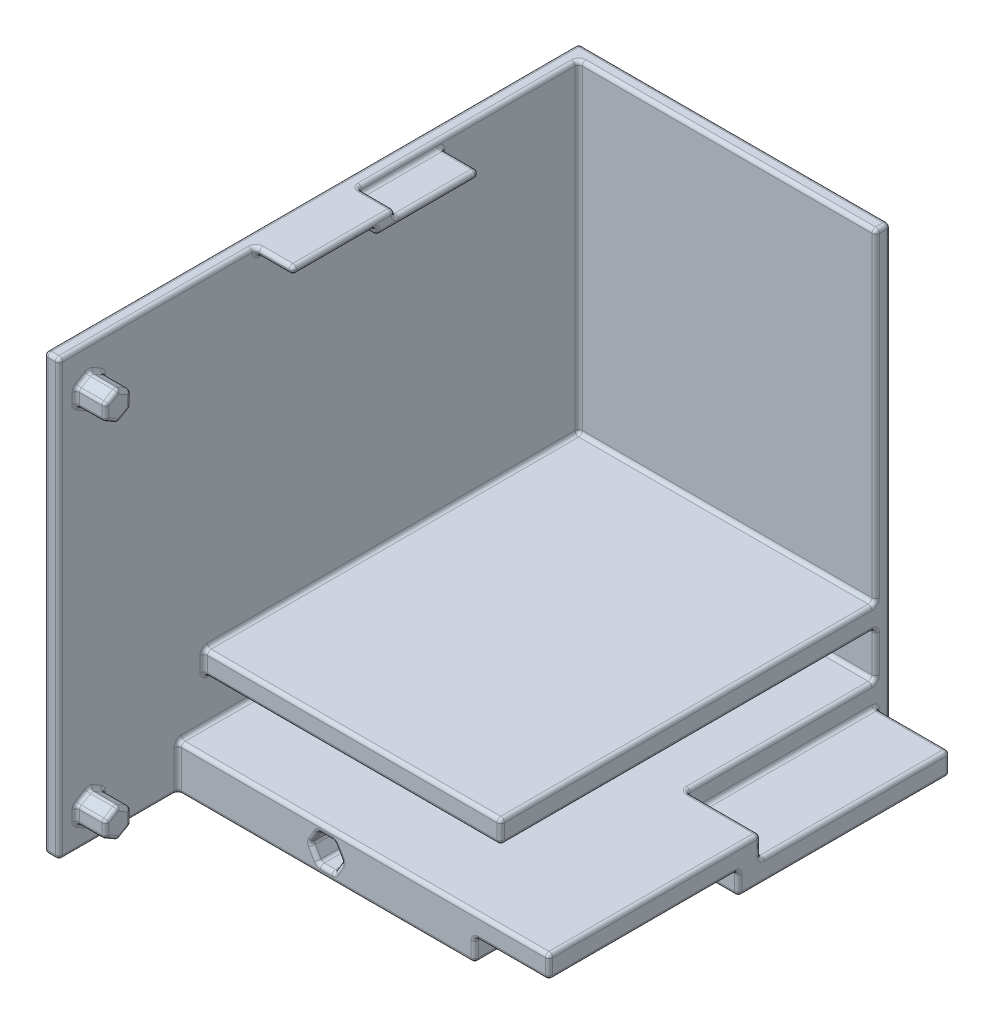
from build123d import *

# Parameters (mm, degrees)
SKETCH3_W            = 144
SKETCH3_H            = 117
BOSS_EXTRUDE2_DEPTH  = 4
BOSS_EXTRUDE3_DEPTH  = 12
BOSS_EXTRUDE4_DEPTH  = 10
SKETCH7_W            = 4
SKETCH7_H            = 117
BOSS_EXTRUDE5_DEPTH  = 80
BOSS_EXTRUDE8_DEPTH  = 20
SKETCH8_W            = 108
SKETCH8_H            = 12
BOSS_EXTRUDE9_DEPTH  = 80
CUT_EXTRUDE1_DEPTH   = 10
SKETCH12_W           = 84
SKETCH12_H           = 6
BOSS_EXTRUDE10_DEPTH = 105
FILLET2_R            = 1


with BuildPart() as part:
    # Sketch3 → Boss-Extrude2 (new body)
    with BuildSketch(Plane(origin=(0, 0, 0), x_dir=(0, 0, -1), z_dir=(1, 0, 0))):
        Rectangle(SKETCH3_W, SKETCH3_H)
    extrude(amount=BOSS_EXTRUDE2_DEPTH)

    # Sketch5 → Boss-Extrude3 (add)
    with BuildSketch(Plane.ZY):
        Polygon((64, -45.67390752), (67.464101615, -47.67390752), (67.464101615, -51.67390752), (64, -53.67390752), (60.535898385, -51.67390752), (60.535898385, -47.67390752), align=None)
        Polygon((60.535898385, 49.67390752), (60.535898385, 45.67390752), (64, 43.67390752), (67.464101615, 45.67390752), (67.464101615, 49.67390752), (64, 51.67390752), align=None)
    extrude(amount=-BOSS_EXTRUDE3_DEPTH)

    # Sketch6 → Boss-Extrude4 (add)
    with BuildSketch(Plane(origin=(4, 0, 0), x_dir=(0, 0, -1), z_dir=(1, 0, 0))):
        Polygon((-19, 58.5), (-19, 56.5), (3.5, 56.5), (3.5, 54.5), (31, 54.5), (31, 56.5), (8.5, 56.5), (8.5, 58.5), align=None)
    extrude(amount=BOSS_EXTRUDE4_DEPTH)

    # Sketch7 → Boss-Extrude5 (add)
    with BuildSketch(Plane(origin=(4, 0, 0), x_dir=(0, 0, -1), z_dir=(1, 0, 0))):
        with Locations((70, 0)):
            Rectangle(SKETCH7_W, SKETCH7_H)
    extrude(amount=BOSS_EXTRUDE5_DEPTH)



with BuildPart() as body_2:
    # Sketch9 → Boss-Extrude8 (new body)
    with BuildSketch(Plane(origin=(84, 0, 0), x_dir=(0, 0, -1), z_dir=(1, 0, 0))):
        Polygon((-40, -46.5), (17, -46.5), (17, -52.5), (68, -52.5), (68, -58.5), (11, -58.5), (11, -52.5), (-40, -52.5), align=None)
    extrude(amount=BOSS_EXTRUDE8_DEPTH)


with BuildPart() as part_1:
    add(part.part)

    add(body_2.part)  # Boss-Extrude9 merges body 2
    # Sketch8 → Boss-Extrude9 (add)
    with BuildSketch(Plane(origin=(4, 0, 0), x_dir=(0, 0, -1), z_dir=(1, 0, 0))):
        with Locations((14, -52.5)):
            Rectangle(SKETCH8_W, SKETCH8_H)
    extrude(amount=BOSS_EXTRUDE9_DEPTH)

    # Sketch10 → Cut-Extrude1 (cut)
    with BuildSketch(Plane.XY.offset(40)):
        Polygon((41.9, -48.862693304), (39.8, -52.5), (44, -52.5), (44, -56.137306696), (46.1, -56.137306696), (48.2, -52.5), (46.1, -48.862693304), align=None)
        Polygon((44, -52.5), (39.8, -52.5), (41.9, -56.137306696), (44, -56.137306696), align=None)
    extrude(amount=-CUT_EXTRUDE1_DEPTH, mode=Mode.SUBTRACT)

    # Sketch12 → Boss-Extrude10 (add)
    with BuildSketch(Plane(origin=(0, 0, -72), x_dir=(-1, 0, 0), z_dir=(0, 0, -1))):
        with Locations((-42, -31.5)):
            Rectangle(SKETCH12_W, SKETCH12_H)
    extrude(amount=-BOSS_EXTRUDE10_DEPTH)

    # Fillet2
    fillet2_edges = [part_1.edges().sort_by_distance(p)[0] for p in [
        (4, 58.5, -38.25),
        (4, 15, -68),
        (44, 58.5, -68),
        (84, 0, -72),
        (84, 58.5, -70),
        (84, 15, -68),
        (84, -58.5, 14.5),
        (4, 0, 72),
        (4, -46.5, -14),
        (44, -46.5, -68),
        (4, -52.5, 40),
        (54, -46.5, 40),
        (44, -58.5, 40),
        (84, -46.5, -42.5),
        (84, -55.5, 40),
        (84, -58.5, -70),
        (84, -52.5, -42.5),
        (94, -52.5, -68),
        (84, -49.5, -17),
        (94, -52.5, -17),
        (94, -46.5, -17),
        (84, -52.5, 14.5),
        (94, -52.5, 40),
        (84, -55.5, -11),
        (94, -52.5, -11),
        (94, -58.5, -11),
        (84, -55.5, -68),
        (94, -58.5, -68),
        (104, -52.5, -42.5),
        (104, -49.5, -17),
        (104, -46.5, 11.5),
        (104, -49.5, 40),
        (104, -52.5, 14.5),
        (104, -55.5, -11),
        (104, -58.5, -39.5),
        (104, -55.5, -68),
        (4, -58.5, 56),
        (44, -56.137306696, 30),
        (46.1, -56.137306696, 35),
        (40.85, -54.318653348, 30),
        (41.9, -56.137306696, 35),
        (40.85, -50.681346652, 30),
        (39.8, -52.5, 35),
        (44, -48.862693304, 30),
        (41.9, -48.862693304, 35),
        (47.15, -50.681346652, 30),
        (46.1, -48.862693304, 35),
        (47.15, -54.318653348, 30),
        (48.2, -52.5, 35),
        (44, -56.137306696, 40),
        (47.15, -54.318653348, 40),
        (47.15, -50.681346652, 40),
        (44, -48.862693304, 40),
        (40.85, -50.681346652, 40),
        (40.85, -54.318653348, 40),
        (84, -40.5, -68),
        (4, -40.5, -68),
        (84, -31.5, 33),
        (84, -34.5, -17.5),
        (44, -34.5, -68),
        (44, -28.5, -68),
        (44, -34.5, 33),
        (4, -34.5, -17.5),
        (4, -28.5, -17.5),
        (44, -28.5, 33),
        (84, -28.5, -17.5),
        (4, -31.5, 33),
        (4, -46.67390752, 65.732050808),
        (4, -49.67390752, 67.464101615),
        (4, -52.67390752, 65.732050808),
        (4, -52.67390752, 62.267949192),
        (4, -49.67390752, 60.535898385),
        (4, -46.67390752, 62.267949192),
        (8, -45.67390752, 64),
        (8, -47.67390752, 67.464101615),
        (8, -51.67390752, 67.464101615),
        (8, -53.67390752, 64),
        (8, -51.67390752, 60.535898385),
        (8, -47.67390752, 60.535898385),
        (12, -46.67390752, 65.732050808),
        (12, -49.67390752, 67.464101615),
        (12, -52.67390752, 65.732050808),
        (12, -52.67390752, 62.267949192),
        (12, -49.67390752, 60.535898385),
        (12, -46.67390752, 62.267949192),
        (0, -58.5, 0),
        (8, 45.67390752, 60.535898385),
        (4, 47.67390752, 60.535898385),
        (12, 47.67390752, 60.535898385),
        (8, 49.67390752, 60.535898385),
        (4, 50.67390752, 62.267949192),
        (12, 50.67390752, 62.267949192),
        (8, 51.67390752, 64),
        (4, 50.67390752, 65.732050808),
        (12, 50.67390752, 65.732050808),
        (8, 49.67390752, 67.464101615),
        (4, 47.67390752, 67.464101615),
        (12, 47.67390752, 67.464101615),
        (8, 45.67390752, 67.464101615),
        (4, 44.67390752, 65.732050808),
        (12, 44.67390752, 65.732050808),
        (8, 43.67390752, 64),
        (4, 44.67390752, 62.267949192),
        (0, 0, 72),
        (12, 44.67390752, 62.267949192),
        (0, 58.5, 0),
        (0, 0, -72),
        (42, -58.5, -72),
        (2, -58.5, 72),
        (2, 58.5, 72),
        (4, 58.5, 45.5),
        (42, 58.5, -72),
        (4, 56.5, 7.75),
        (9, 56.5, 19),
        (4, 55.5, -3.5),
        (9, 56.5, -3.5),
        (4, 54.5, -17.25),
        (9, 54.5, -3.5),
        (4, 55.5, -31),
        (9, 54.5, -31),
        (4, 56.5, -19.75),
        (9, 56.5, -31),
        (4, 57.5, -8.5),
        (9, 56.5, -8.5),
        (9, 58.5, -8.5),
        (4, 57.5, 19),
        (9, 58.5, 19),
        (14, 56.5, 7.75),
        (14, 55.5, -3.5),
        (14, 54.5, -17.25),
        (14, 55.5, -31),
        (14, 56.5, -19.75),
        (14, 57.5, -8.5),
        (14, 58.5, 5.25),
        (14, 57.5, 19),
    ]]
    fillet(fillet2_edges, radius=FILLET2_R - 0.0001)  # a hair under: the kernel refuses the full size


solid = part_1.part
